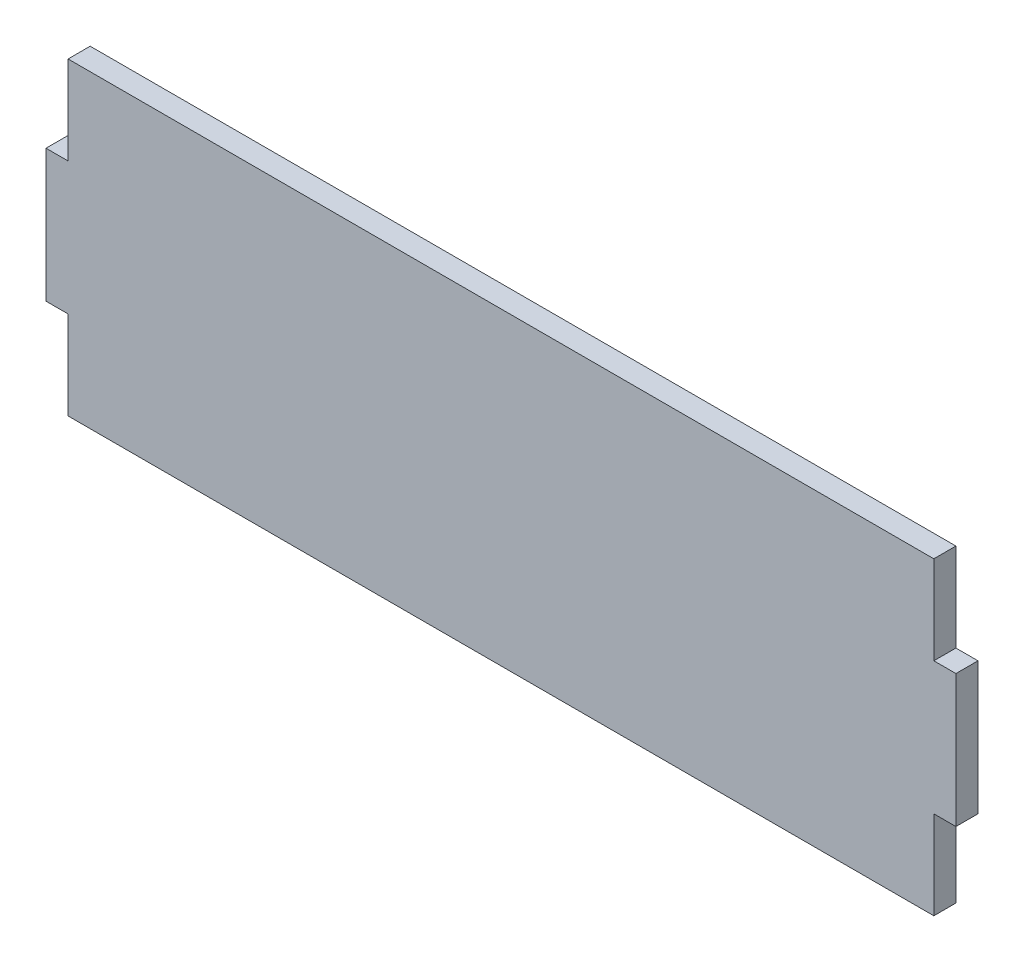
from build123d import *

# Parameters (mm, degrees)
BOSS_EXTRU_1_DEPTH = 5


with BuildPart() as part:
    # Esquisse1 → Boss.-Extru.1 (new body)
    with BuildSketch(Plane.XY):
        Polygon((0, 0), (196, 0), (196, 20), (201, 20), (201, 50), (196, 50), (196, 70), (0, 70), (0, 50), (-5, 50), (-5, 20), (0, 20), align=None)
    extrude(amount=BOSS_EXTRU_1_DEPTH)


solid = part.part
